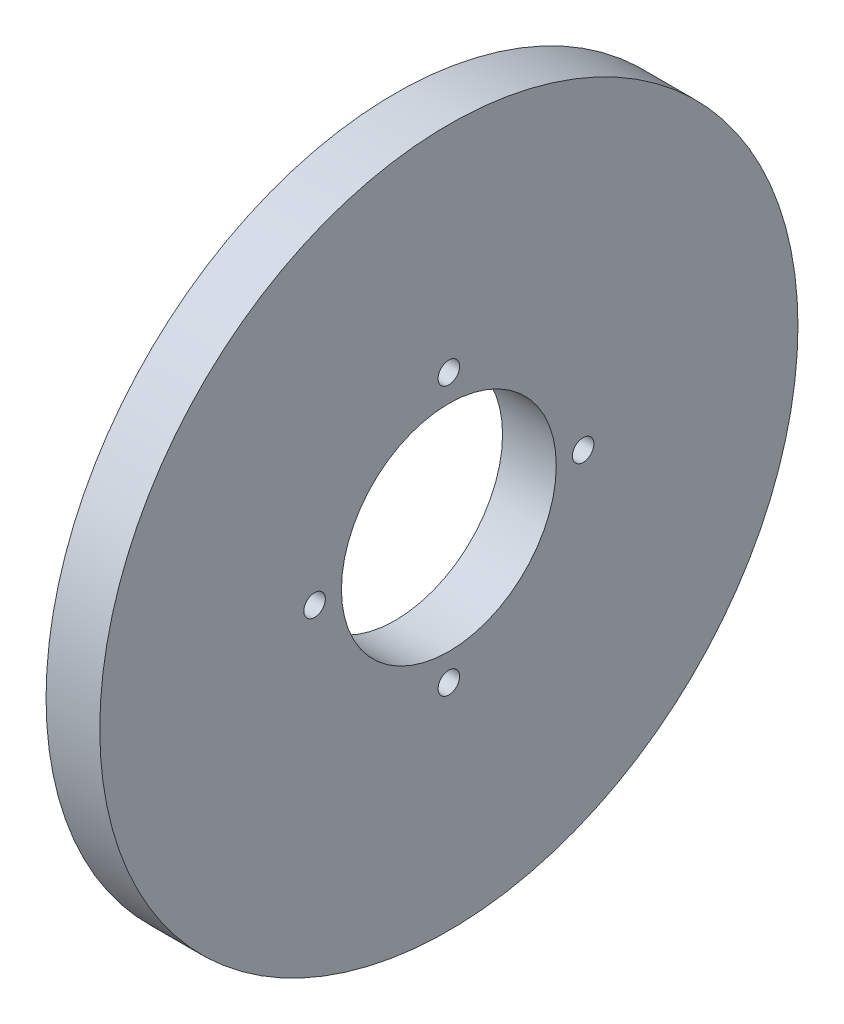
from build123d import *

# Parameters (mm, degrees)
SKETCH1_R           = 65
SKETCH1_R_2         = 20
BOSS_EXTRUDE1_DEPTH = 5
SKETCH2_R           = 2
CUT_EXTRUDE1_DEPTH  = 93.466210045


with BuildPart() as part:
    # Sketch1 → Boss-Extrude1 (new, symmetric)
    with BuildSketch(Plane(origin=(0, 0, 0), x_dir=(0, 0, -1), z_dir=(1, 0, 0))):
        Circle(SKETCH1_R)
        Circle(SKETCH1_R_2, mode=Mode.SUBTRACT)
    extrude(amount=BOSS_EXTRUDE1_DEPTH, both=True)

    # Sketch2 → Cut-Extrude1 (cut, through all)
    with BuildSketch(Plane(origin=(5, 0, 0), x_dir=(0, 0, -1), z_dir=(1, 0, 0))):
        with Locations((0, 25)):
            Circle(SKETCH2_R)
        with Locations((25, 0)):
            Circle(SKETCH2_R)
        with Locations((0, -25)):
            Circle(SKETCH2_R)
        with Locations((-25, 0)):
            Circle(SKETCH2_R)
    extrude(amount=-CUT_EXTRUDE1_DEPTH, mode=Mode.SUBTRACT)


solid = part.part
